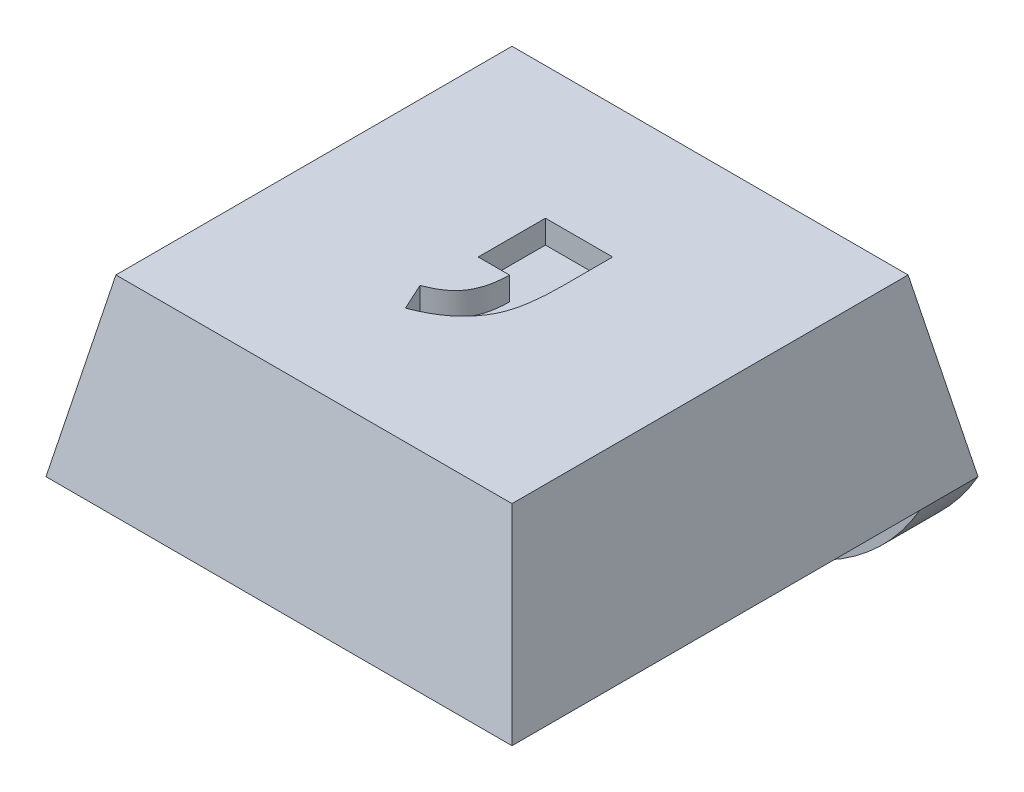
from build123d import *

# Parameters (mm, degrees)
SKETCH1_W               = 8
SKETCH1_H               = 8
BOSS_EXTRUDE1_DEPTH     = 3
CUT_EXTRUDE1_DEPTH      = 12.704699911
CUT_EXTRUDE1_DEPTH_BACK = 12.704699911
CUT_EXTRUDE2_DEPTH      = 11
SKETCH4_R               = 1.75
CUT_EXTRUDE3_DEPTH      = 0.4
SKETCH5_W               = 8
SKETCH5_H               = 1
BOSS_EXTRUDE2_DEPTH     = 2
FILLET1_R               = 4
CUT_EXTRUDE4_DEPTH      = 0.4


with BuildPart() as part:
    # Sketch1 → Boss-Extrude1 (new body)
    with BuildSketch(Plane(origin=(0, 0, 0), x_dir=(1, 0, 0), z_dir=(0, 1, 0))):
        with Locations((4, 4)):
            Rectangle(SKETCH1_W, SKETCH1_H)
    extrude(amount=BOSS_EXTRUDE1_DEPTH)

    # Sketch2 → Cut-Extrude1 (cut, two sides: drawn at the far end of the back side and taken through both)
    with BuildSketch(Plane.XY.offset(-CUT_EXTRUDE1_DEPTH_BACK)):
        Polygon((0, 0), (0.6, 3), (0, 3), align=None)
        Polygon((8, 0), (7.4, 3), (8, 3), align=None)
    extrude(amount=CUT_EXTRUDE1_DEPTH + CUT_EXTRUDE1_DEPTH_BACK, mode=Mode.SUBTRACT)

    # Sketch3 → Cut-Extrude2 (cut)
    with BuildSketch(Plane(origin=(0, 0, 0), x_dir=(0, 0, -1), z_dir=(1, 0, 0))):
        Polygon((0, 0), (0.6, 3), (0, 3), align=None)
        Polygon((8, 3), (7.4, 3), (8, 0), align=None)
    extrude(amount=CUT_EXTRUDE2_DEPTH, mode=Mode.SUBTRACT)

    # Sketch4 → Cut-Extrude3 (cut)
    with BuildSketch(Plane.XZ):
        with Locations(Location((4, -3.75, 0), (0, 0, 270))):
            Circle(SKETCH4_R)
    extrude(amount=-CUT_EXTRUDE3_DEPTH, mode=Mode.SUBTRACT)

    # Sketch5 → Boss-Extrude2 (add)
    with BuildSketch(Plane.XZ):
        with Locations((4, -7.5)):
            Rectangle(SKETCH5_W, SKETCH5_H)
    extrude(amount=BOSS_EXTRUDE2_DEPTH)

    # Fillet1
    # the kernel refuses this fillet: 4 mm, written as the material it takes off along each edge
    with BuildSketch(Plane(origin=(8, -2, -16.660254038), x_dir=(0, 1, 0), z_dir=(0, 0, 1)), Plane(origin=(0, -2, 1.660254038), x_dir=(0, 1, 0), z_dir=(0, 0, -1))) as fillet1_piece_1:
        with BuildLine():
            CenterArc((4, 3.464101615), FILLET1_R, 180, 60)
            Line((0, 3.464101615), (-0.08, 3.464101615))
            Line((-0.08, 3.464101615), (-0.08, 0))
            Line((-0.08, 0), (0, -0.08))
            ThreePointArc((0, -0.08), (1, -0.08), (1.96, -0.069282032))
            Line((1.96, -0.069282032), (2, 0))
        make_face()
    extrude(amount=18.320508076, mode=Mode.SUBTRACT)

    # Sketch6 → Cut-Extrude4 (cut)
    with BuildSketch(Plane(origin=(0, 3, 0), x_dir=(1, 0, 0), z_dir=(0, 1, 0))):
        with BuildLine():
            Line((3.443331895, 5.130686034), (4.597178049, 5.130686034))
            Line((4.597178049, 5.130686034), (4.597178049, 4.291743727))
            add(Edge.make_bspline(
                [(4.597178049, 4.291743727), (4.596645702, 4.211170655), (4.595640561, 4.059038126), (4.578021597, 3.844434295), (4.553540207, 3.655975372), (4.51459395, 3.491238943), (4.462448704, 3.342468302), (4.388723742, 3.206338125), (4.298056147, 3.076066307), (4.187154731, 2.955594738), (4.059577941, 2.844170634), (3.913847481, 2.747275335), (3.753421756, 2.660946408), (3.638168327, 2.615497851), (3.579149203, 2.592224496)],
                knots=[0, 0, 0, 0, 1.347156832, 2.543608823, 3.599300285, 4.522475688, 5.370350604, 6.227678973, 7.103274953, 8.018757603, 8.959280198, 9.929437417, 10.939703653, 12, 12, 12, 12], degree=3))
            Line((3.579149203, 2.592224496), (3.366408818, 3.053762957))
            add(Edge.make_bspline(
                [(3.366408818, 3.053762957), (3.417874874, 3.07492834), (3.516080495, 3.11531534), (3.647721841, 3.193115232), (3.754216523, 3.284666717), (3.839841548, 3.388423011), (3.901059293, 3.510472084), (3.947065575, 3.648752862), (3.973734578, 3.806802537), (3.979016553, 3.918249261), (3.981793434, 3.976839881)],
                knots=[0, 0, 0, 0, 1.113959817, 2.125616841, 3.047494432, 3.914868512, 4.801521967, 5.765947312, 6.825496818, 8, 8, 8, 8], degree=3))
            Line((3.981793434, 3.976839881), (3.443331895, 3.976839881))
            Line((3.443331895, 3.976839881), (3.443331895, 5.130686034))
        make_face()
    extrude(amount=-CUT_EXTRUDE4_DEPTH, mode=Mode.SUBTRACT)


solid = part.part
